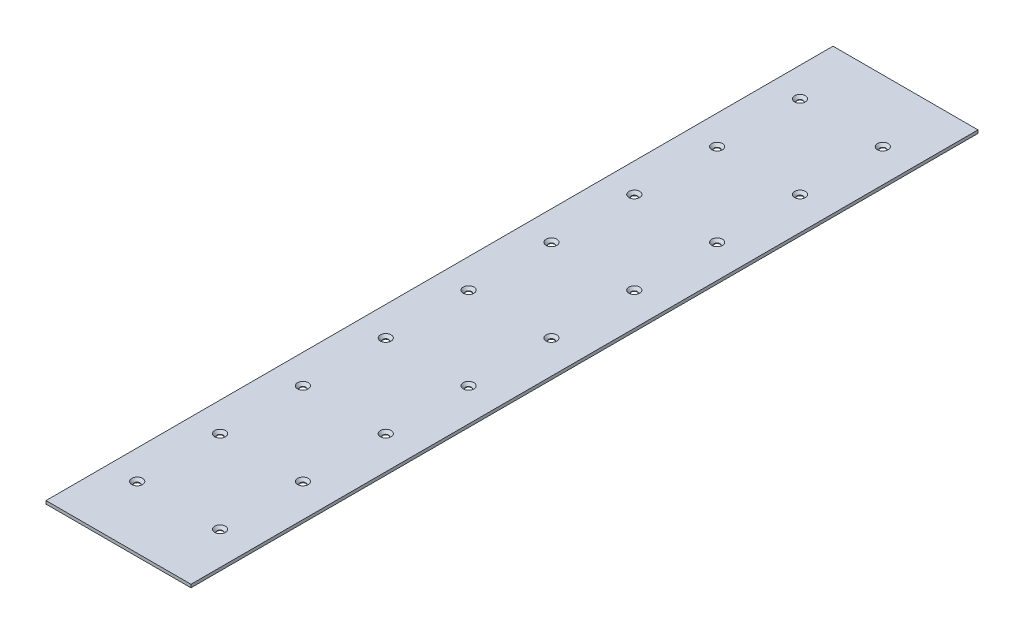
from build123d import *

# Parameters (mm, degrees)
BASE_FLANGE1_START                           = -380
BASE_FLANGE1_OUTLINE_W                       = 140
BASE_FLANGE1_OUTLINE_H                       = 3
BASE_FLANGE1_DEPTH                           = 760
CSK_FOR_M5_COUNTERSUNK_FLAT_HEAD_SCR_2_COUNT = 2
CSK_FOR_M5_COUNTERSUNK_FLAT_HEAD_SCR_2_PITCH = 80
CSK_FOR_M5_COUNTERSUNK_FLAT_HEAD_SCR_3_COUNT = 2
CSK_FOR_M5_COUNTERSUNK_FLAT_HEAD_SCR_3_PITCH = 160
CSK_FOR_M5_COUNTERSUNK_FLAT_HEAD_SCR_4_COUNT = 2
CSK_FOR_M5_COUNTERSUNK_FLAT_HEAD_SCR_4_PITCH = 240
CSK_FOR_M5_COUNTERSUNK_FLAT_HEAD_SCR_5_COUNT = 2
CSK_FOR_M5_COUNTERSUNK_FLAT_HEAD_SCR_5_PITCH = 320
CSK_FOR_M5_COUNTERSUNK_FLAT_HEAD_SCR_6_COUNT = 2
CSK_FOR_M5_COUNTERSUNK_FLAT_HEAD_SCR_6_PITCH = 80
CSK_FOR_M5_COUNTERSUNK_FLAT_HEAD_SCR_7_COUNT = 2
CSK_FOR_M5_COUNTERSUNK_FLAT_HEAD_SCR_7_PITCH = 160
CSK_FOR_M5_COUNTERSUNK_FLAT_HEAD_SCR_8_COUNT = 2
CSK_FOR_M5_COUNTERSUNK_FLAT_HEAD_SCR_8_PITCH = 240
CSK_FOR_M5_COUNTERSUNK_FLAT_HEAD_SCR_9_COUNT = 2
CSK_FOR_M5_COUNTERSUNK_FLAT_HEAD_SCR_9_PITCH = 320
CRVPATTERN1_COUNT                            = 2
CRVPATTERN1_PITCH                            = 80


# Read off the part's stored shape, not the designer's step: Base-Flange1
with BuildPart() as part:
    # Base-Flange1 outline → Base-Flange1 (new body)
    with BuildSketch(Plane.XY.offset(BASE_FLANGE1_START)):
        with Locations((70, -1.5)):
            Rectangle(BASE_FLANGE1_OUTLINE_W, BASE_FLANGE1_OUTLINE_H)
    extrude(amount=BASE_FLANGE1_DEPTH)

    # Sketch7 → CSK for M5 Countersunk Flat Head Screw1 (revolve, cut)
    with BuildSketch(Plane(origin=(28.094118078, 0, 0), x_dir=(0, 0, 1), z_dir=(1, 0, 0))):
        Polygon((0, 0), (0, 3), (2.75, 3), (2.75, 2.45), (5.2, 0), align=None)
    csk_for_m5_countersunk_flat_head_screw1 = revolve(axis=Axis((28.094118078, 6.35, 0), (0, -1, 0)), mode=Mode.SUBTRACT)

    # CSK for M5 Countersunk Flat Head Scr 2: CSK for M5 Countersunk Flat Head Screw1 ×2
    with Locations(*[(0, 0, -i * CSK_FOR_M5_COUNTERSUNK_FLAT_HEAD_SCR_2_PITCH) for i in range(1, CSK_FOR_M5_COUNTERSUNK_FLAT_HEAD_SCR_2_COUNT)]):
        add(csk_for_m5_countersunk_flat_head_screw1, mode=Mode.SUBTRACT)

    # CSK for M5 Countersunk Flat Head Scr 3: CSK for M5 Countersunk Flat Head Screw1 ×2
    with Locations(*[(0, 0, -i * CSK_FOR_M5_COUNTERSUNK_FLAT_HEAD_SCR_3_PITCH) for i in range(1, CSK_FOR_M5_COUNTERSUNK_FLAT_HEAD_SCR_3_COUNT)]):
        add(csk_for_m5_countersunk_flat_head_screw1, mode=Mode.SUBTRACT)

    # CSK for M5 Countersunk Flat Head Scr 4: CSK for M5 Countersunk Flat Head Screw1 ×2
    with Locations(*[(0, 0, -i * CSK_FOR_M5_COUNTERSUNK_FLAT_HEAD_SCR_4_PITCH) for i in range(1, CSK_FOR_M5_COUNTERSUNK_FLAT_HEAD_SCR_4_COUNT)]):
        add(csk_for_m5_countersunk_flat_head_screw1, mode=Mode.SUBTRACT)

    # CSK for M5 Countersunk Flat Head Scr 5: CSK for M5 Countersunk Flat Head Screw1 ×2
    with Locations(*[(0, 0, -i * CSK_FOR_M5_COUNTERSUNK_FLAT_HEAD_SCR_5_PITCH) for i in range(1, CSK_FOR_M5_COUNTERSUNK_FLAT_HEAD_SCR_5_COUNT)]):
        add(csk_for_m5_countersunk_flat_head_screw1, mode=Mode.SUBTRACT)

    # CSK for M5 Countersunk Flat Head Scr 6: CSK for M5 Countersunk Flat Head Screw1 ×2
    with Locations(*[(0, 0, i * CSK_FOR_M5_COUNTERSUNK_FLAT_HEAD_SCR_6_PITCH) for i in range(1, CSK_FOR_M5_COUNTERSUNK_FLAT_HEAD_SCR_6_COUNT)]):
        add(csk_for_m5_countersunk_flat_head_screw1, mode=Mode.SUBTRACT)

    # CSK for M5 Countersunk Flat Head Scr 7: CSK for M5 Countersunk Flat Head Screw1 ×2
    with Locations(*[(0, 0, i * CSK_FOR_M5_COUNTERSUNK_FLAT_HEAD_SCR_7_PITCH) for i in range(1, CSK_FOR_M5_COUNTERSUNK_FLAT_HEAD_SCR_7_COUNT)]):
        add(csk_for_m5_countersunk_flat_head_screw1, mode=Mode.SUBTRACT)

    # CSK for M5 Countersunk Flat Head Scr 8: CSK for M5 Countersunk Flat Head Screw1 ×2
    with Locations(*[(0, 0, i * CSK_FOR_M5_COUNTERSUNK_FLAT_HEAD_SCR_8_PITCH) for i in range(1, CSK_FOR_M5_COUNTERSUNK_FLAT_HEAD_SCR_8_COUNT)]):
        add(csk_for_m5_countersunk_flat_head_screw1, mode=Mode.SUBTRACT)

    # CSK for M5 Countersunk Flat Head Scr 9: CSK for M5 Countersunk Flat Head Screw1 ×2
    with Locations(*[(0, 0, i * CSK_FOR_M5_COUNTERSUNK_FLAT_HEAD_SCR_9_PITCH) for i in range(1, CSK_FOR_M5_COUNTERSUNK_FLAT_HEAD_SCR_9_COUNT)]):
        add(csk_for_m5_countersunk_flat_head_screw1, mode=Mode.SUBTRACT)

    # CrvPattern1: CSK for M5 Countersunk Flat Head Screw1 ×2
    with Locations(*[(i * CRVPATTERN1_PITCH, 0, 0) for i in range(1, CRVPATTERN1_COUNT)]):
        add(csk_for_m5_countersunk_flat_head_screw1, mode=Mode.SUBTRACT)

    # CrvPattern1 copy 1 sketch → CrvPattern1 copy 1 (revolve, cut)
    with BuildSketch(Plane(origin=(108.094118078, 0, -80), x_dir=(0, 0, 1), z_dir=(1, 0, 0))):
        Polygon((0, 0), (0, 3), (2.75, 3), (2.75, 2.45), (5.2, 0), align=None)
    revolve(axis=Axis((108.094118078, 6.35, -80), (0, -1, 0)), mode=Mode.SUBTRACT)

    # CrvPattern1 copy 2 sketch → CrvPattern1 copy 2 (revolve, cut)
    with BuildSketch(Plane(origin=(108.094118078, 0, -160), x_dir=(0, 0, 1), z_dir=(1, 0, 0))):
        Polygon((0, 0), (0, 3), (2.75, 3), (2.75, 2.45), (5.2, 0), align=None)
    revolve(axis=Axis((108.094118078, 6.35, -160), (0, -1, 0)), mode=Mode.SUBTRACT)

    # CrvPattern1 copy 3 sketch → CrvPattern1 copy 3 (revolve, cut)
    with BuildSketch(Plane(origin=(108.094118078, 0, -240), x_dir=(0, 0, 1), z_dir=(1, 0, 0))):
        Polygon((0, 0), (0, 3), (2.75, 3), (2.75, 2.45), (5.2, 0), align=None)
    revolve(axis=Axis((108.094118078, 6.35, -240), (0, -1, 0)), mode=Mode.SUBTRACT)

    # CrvPattern1 copy 4 sketch → CrvPattern1 copy 4 (revolve, cut)
    with BuildSketch(Plane(origin=(108.094118078, 0, -320), x_dir=(0, 0, 1), z_dir=(1, 0, 0))):
        Polygon((0, 0), (0, 3), (2.75, 3), (2.75, 2.45), (5.2, 0), align=None)
    revolve(axis=Axis((108.094118078, 6.35, -320), (0, -1, 0)), mode=Mode.SUBTRACT)

    # CrvPattern1 copy 5 sketch → CrvPattern1 copy 5 (revolve, cut)
    with BuildSketch(Plane(origin=(108.094118078, 0, 80), x_dir=(0, 0, 1), z_dir=(1, 0, 0))):
        Polygon((0, 0), (0, 3), (2.75, 3), (2.75, 2.45), (5.2, 0), align=None)
    revolve(axis=Axis((108.094118078, 6.35, 80), (0, -1, 0)), mode=Mode.SUBTRACT)

    # CrvPattern1 copy 6 sketch → CrvPattern1 copy 6 (revolve, cut)
    with BuildSketch(Plane(origin=(108.094118078, 0, 160), x_dir=(0, 0, 1), z_dir=(1, 0, 0))):
        Polygon((0, 0), (0, 3), (2.75, 3), (2.75, 2.45), (5.2, 0), align=None)
    revolve(axis=Axis((108.094118078, 6.35, 160), (0, -1, 0)), mode=Mode.SUBTRACT)

    # CrvPattern1 copy 7 sketch → CrvPattern1 copy 7 (revolve, cut)
    with BuildSketch(Plane(origin=(108.094118078, 0, 240), x_dir=(0, 0, 1), z_dir=(1, 0, 0))):
        Polygon((0, 0), (0, 3), (2.75, 3), (2.75, 2.45), (5.2, 0), align=None)
    revolve(axis=Axis((108.094118078, 6.35, 240), (0, -1, 0)), mode=Mode.SUBTRACT)

    # CrvPattern1 copy 8 sketch → CrvPattern1 copy 8 (revolve, cut)
    with BuildSketch(Plane(origin=(108.094118078, 0, 320), x_dir=(0, 0, 1), z_dir=(1, 0, 0))):
        Polygon((0, 0), (0, 3), (2.75, 3), (2.75, 2.45), (5.2, 0), align=None)
    revolve(axis=Axis((108.094118078, 6.35, 320), (0, -1, 0)), mode=Mode.SUBTRACT)


solid = part.part
